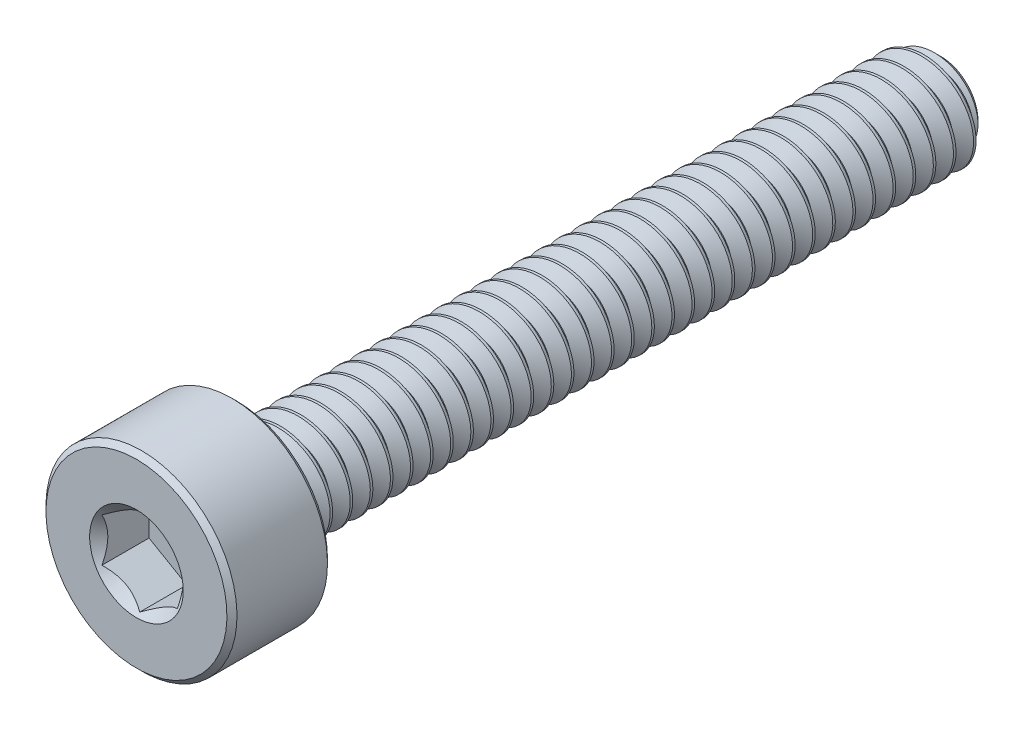
from build123d import *

# Parameters (mm, degrees)
CUT_EXTRUDE1_DEPTH     = 1
SPLIT1_SURFACE_1_BACK  = 17.878
SPLIT1_SURFACE_1_DEPTH = 35.756
SPLIT1_SURFACE_2_BACK  = 17.878
SPLIT1_SURFACE_2_DEPTH = 35.756
CUT_SWEEP1_PITCH       = 0.4
CUT_SWEEP1_TO          = 13.9


with BuildPart() as part:
    # Sketch2 → Revolve1 (revolve)
    with BuildSketch(Plane(origin=(0, 0, 0), x_dir=(0, 0, -1), z_dir=(1, 0, 0))):
        with BuildLine():
            Line((-8, 0), (-8, 1.8))
            Line((-8, 1.8), (-7.9, 1.9))
            Line((-7.9, 1.9), (-6.1, 1.9))
            Line((-6.1, 1.9), (-6, 1.8))
            Line((-6, 1.8), (-6, 1.1))
            ThreePointArc((-6, 1.1), (-5.970710678, 1.029289322), (-5.9, 1))
            Line((-5.9, 1), (7.740192379, 1))
            Line((7.740192379, 1), (8, 0.740192379))
            Line((8, 0.740192379), (8, 0))
            Line((8, 0), (-8, 0))
        make_face()
    revolve(axis=Axis((0, 0, -8), (0, 0, 1)))

    # Sketch3 → Cut-Extrude1 (cut)
    with BuildSketch(Plane.XY.offset(8)):
        Polygon((0.75, -0.433012702), (0.75, 0.433012702), (0, 0.866025404), (-0.75, 0.433012702), (-0.75, -0.433012702), (0, -0.866025404), align=None)
    extrude(amount=-CUT_EXTRUDE1_DEPTH, mode=Mode.SUBTRACT)

    # Cut-Extrude2 cone 1 section (through the dimple's axis) → Cut-Extrude2 (revolve, cut)
    with BuildSketch(Plane(origin=(0, 0, 8), x_dir=(0, -1, 0), z_dir=(1, 0, 0))):
        Polygon((0, 0), (0.930977309, 0), (0, 0.930977309), align=None)
    revolve(axis=Axis((0, 0, 8), (0, 0, -1)), mode=Mode.SUBTRACT)


with BuildPart() as body_2:
    # Split1: the piece behind the surface
    add(part.part)
    # Split1 surface: a surface, the sketch's curves swept straight by 35.756 mm
    with BuildLine(Plane(origin=(0, 0, 0), x_dir=(0, 0, -1), z_dir=(1, 0, 0)).offset(-SPLIT1_SURFACE_1_BACK), mode=Mode.PRIVATE) as split1_surface_1_path:
        Line((-5.9, -1.9), (-5.9, 1.9))
    split1_surface_1 = Shell.extrude(split1_surface_1_path.wire(), (1 * SPLIT1_SURFACE_1_DEPTH, 0 * SPLIT1_SURFACE_1_DEPTH, 0 * SPLIT1_SURFACE_1_DEPTH))
    split(bisect_by=split1_surface_1, keep=Keep.BOTTOM)

    # Cut-Sweep1: arcs per turn and ends read off the stored shape
    # Cut-Sweep1: the profile of Sketch7 screwed along a right-hand helix through 36 turns, 6 arcs to a turn; built about Z, then put on its axis
    cut_sweep1_z = Axis((0, 0, 0), (0, 0, 1))
    cut_sweep1_corners = [(1.021650635, 0, 0.0125), (1.021650635, 0, -0.3625), (0.740192379, 0, -0.2), (0.740192379, 0, -0.15)]
    with BuildLine(mode=Mode.PRIVATE) as cut_sweep1_profile:
        Line(cut_sweep1_corners[0], cut_sweep1_corners[1])
        Line(cut_sweep1_corners[1], cut_sweep1_corners[2])
        Line(cut_sweep1_corners[2], cut_sweep1_corners[3])
        Line(cut_sweep1_corners[3], cut_sweep1_corners[0])
    cut_sweep1_cap = Face(cut_sweep1_profile.wire())
    cut_sweep1_turn_angles = [0, 30, 60, 90, 120, 150, 180, 210, 240, 270, 300, 330, 360]
    cut_sweep1_turn_weights = [1, 0.8660254037844387, 1, 0.8660254037844387, 1, 0.8660254037844387, 1, 0.8660254037844387, 1, 0.8660254037844387, 1, 0.8660254037844387, 1]
    cut_sweep1_turn_rails = [Edge.make_bspline([Vector(p[0], p[1], 0).rotate(cut_sweep1_z, cut_sweep1_turn_angles[k]) / cut_sweep1_turn_weights[k] + Vector(0, 0, p[2] + CUT_SWEEP1_PITCH * cut_sweep1_turn_angles[k] / 360) for k in range(13)], [0, 0, 0, 1, 1, 2, 2, 3, 3, 4, 4, 5, 5, 6, 6, 6], 2, cut_sweep1_turn_weights) for p in cut_sweep1_corners]
    cut_sweep1_turn_sides = [Face.make_surface_from_curves(cut_sweep1_turn_rails[p[0]], cut_sweep1_turn_rails[p[1]]) for p in [(0, 1), (1, 2), (2, 3), (3, 0)]]
    cut_sweep1 = Plane(origin=(0, 0, -8), x_dir=(0, 1, 0), z_dir=(0, 0, 1)) * split(Solid(Shell([*[p.moved(Location((0, 0, CUT_SWEEP1_PITCH * i))) for i in range(36) for p in cut_sweep1_turn_sides], cut_sweep1_cap, cut_sweep1_cap.rotate(cut_sweep1_z, 12960).moved(Location((0, 0, CUT_SWEEP1_PITCH * 12960 / 360)))])), bisect_by=Plane.XY.offset(CUT_SWEEP1_TO), keep=Keep.BOTTOM, mode=Mode.PRIVATE)
    add(cut_sweep1, mode=Mode.SUBTRACT)


with BuildPart() as part_1:
    add(part.part)

    # Split1: split by a surface, the side it looks to stays
    # Split1 surface: a surface, the sketch's curves swept straight by 35.756 mm
    with BuildLine(Plane(origin=(0, 0, 0), x_dir=(0, 0, -1), z_dir=(1, 0, 0)).offset(-SPLIT1_SURFACE_2_BACK), mode=Mode.PRIVATE) as split1_surface_2_path:
        Line((-5.9, -1.9), (-5.9, 1.9))
    split1_surface_2 = Shell.extrude(split1_surface_2_path.wire(), (1 * SPLIT1_SURFACE_2_DEPTH, 0 * SPLIT1_SURFACE_2_DEPTH, 0 * SPLIT1_SURFACE_2_DEPTH))
    split(bisect_by=split1_surface_2, keep=Keep.TOP)

    add(body_2.part)  # Revolve2 merges body 2
    # Sketch8 → Revolve2 (revolve)
    with BuildSketch(Plane(origin=(0, 0, 0), x_dir=(0, 0, -1), z_dir=(1, 0, 0)), mode=Mode.PRIVATE) as revolve2_sk:
        Polygon((-6, 0), (-6, 1), (-5.9, 1), (-5.322649731, 0), align=None)
    revolve(revolve2_sk.sketch.rotate(Axis((0, 0, 5.322649731), (0, 0, 1)), 270), axis=Axis((0, 0, 5.322649731), (0, 0, 1)))


solid = part_1.part
